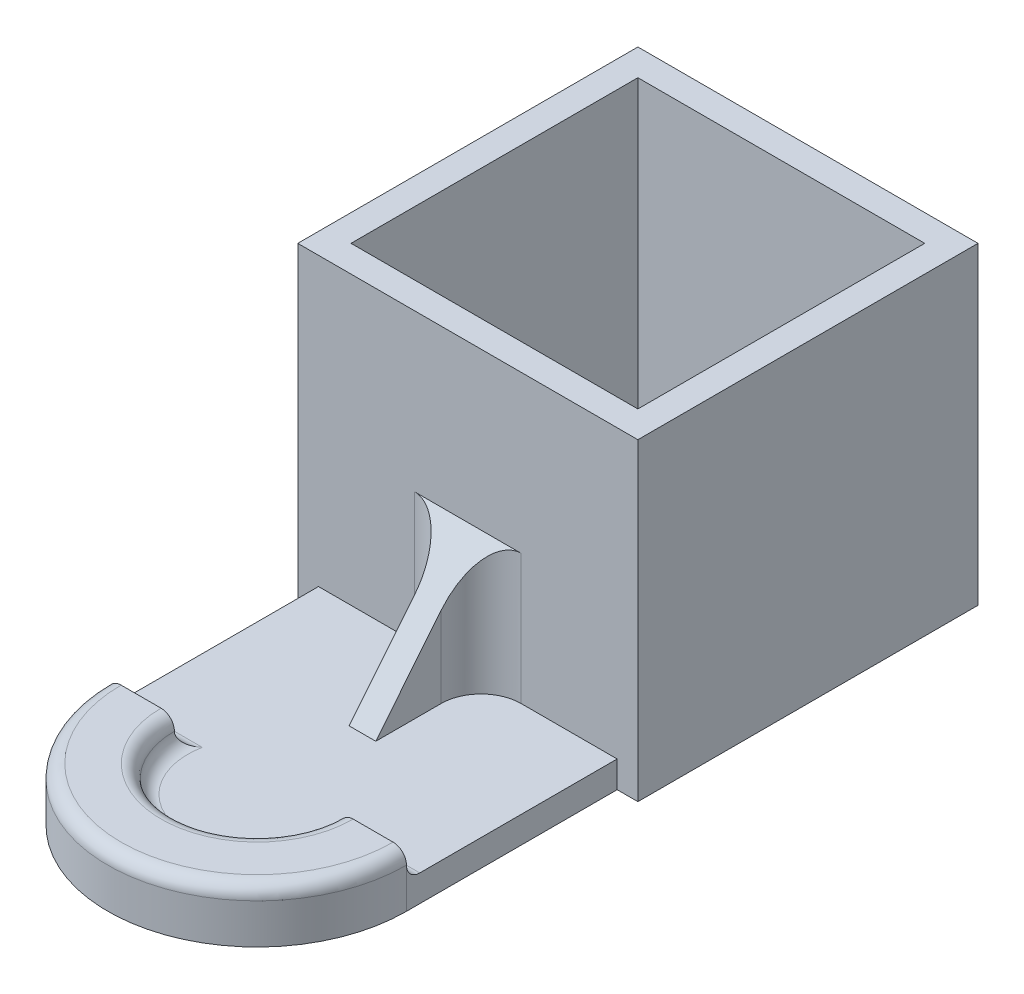
from build123d import *

# Parameters (mm, degrees)
SKETCH1_W           = 25.5443469
SKETCH1_H           = 25.5443469
SKETCH1_W_2         = 21.5443469
SKETCH1_H_2         = 21.5443469
EXTRUDE_THIN1_DEPTH = 21.5443469
SKETCH2_W           = 25.5443469
SKETCH2_H           = 25.5443469
BOSS_EXTRUDE1_DEPTH = 2
BOSS_EXTRUDE2_DEPTH = 2
BOSS_EXTRUDE3_DEPTH = 1
FILLET2_R           = 3
EXTRUDE_THIN2_DEPTH = 2
FILLET3_R           = 1


with BuildPart() as part:
    # Sketch1 → Extrude-Thin1 (new body)
    with BuildSketch(Plane(origin=(0, 0, 0), x_dir=(1, 0, 0), z_dir=(0, 1, 0))):
        with Locations((10.77217345, 10.77217345)):
            Rectangle(SKETCH1_W, SKETCH1_H)
        with Locations((10.77217345, 10.77217345)):
            Rectangle(SKETCH1_W_2, SKETCH1_H_2, mode=Mode.SUBTRACT)
    extrude(amount=EXTRUDE_THIN1_DEPTH)

    # Sketch2 → Boss-Extrude1 (add)
    with BuildSketch(Plane.XZ):
        with Locations((10.77217345, -10.77217345)):
            Rectangle(SKETCH2_W, SKETCH2_H)
    extrude(amount=BOSS_EXTRUDE1_DEPTH)

    # Sketch4 → Boss-Extrude2 (add)
    with BuildSketch(Plane.XZ.offset(2)):
        with BuildLine():
            Line((-0.443258652, 2), (-0.443258652, 17.823551836))
            ThreePointArc((-0.443258652, 17.823551836), (10.77217345, 29.038983939), (21.987605552, 17.823551836))
            Line((21.987605552, 17.823551836), (21.987605552, 2))
            ThreePointArc((21.987605552, 2), (10.77217345, -9.215432102), (-0.443258652, 2))
        make_face()
    extrude(amount=-BOSS_EXTRUDE2_DEPTH)

    # Sketch5 → Boss-Extrude3 (add, symmetric)
    with BuildSketch(Plane(origin=(10.77217345, 0, 0), x_dir=(0, 0, -1), z_dir=(1, 0, 0))):
        Polygon((-2, 9.77217345), (-9.911775918, 0), (-2, 0), align=None)
    extrude(amount=BOSS_EXTRUDE3_DEPTH, both=True)

    # Fillet2
    fillet2_edges = [part.edges().sort_by_distance(p)[0] for p in [
        (9.77217345, 4.886086725, 2),
        (11.77217345, 4.886086725, 2),
    ]]
    fillet(fillet2_edges, radius=FILLET2_R)

    # Sketch6 → Extrude-Thin2 (add)
    with BuildSketch(Plane(origin=(0, 0, 0), x_dir=(1, 0, 0), z_dir=(0, 1, 0))):
        with BuildLine():
            ThreePointArc((-0.443258652, -17.823551836), (10.77217345, -29.038983939), (21.987605552, -17.823551836))
            Line((21.987605552, -17.823551836), (16.987605552, -17.823551836))
            ThreePointArc((16.987605552, -17.823551836), (10.77217345, -24.038983939), (4.556741348, -17.823551836))
            Line((4.556741348, -17.823551836), (-0.443258652, -17.823551836))
        make_face()
    extrude(amount=EXTRUDE_THIN2_DEPTH)

    # Fillet3
    fillet3_edges = [part.edges().sort_by_distance(p)[0] for p in [
        (19.487605552, 0, 17.823551836),
        (2.056741348, 0, 17.823551836),
        (10.77217345, 2, 29.038983939),
        (10.77217345, 2, 24.038983939),
        (10.77217345, 0, 24.038983939),
    ]]
    fillet(fillet3_edges, radius=FILLET3_R - 0.0001)  # a hair under: the kernel refuses the full size


solid = part.part
